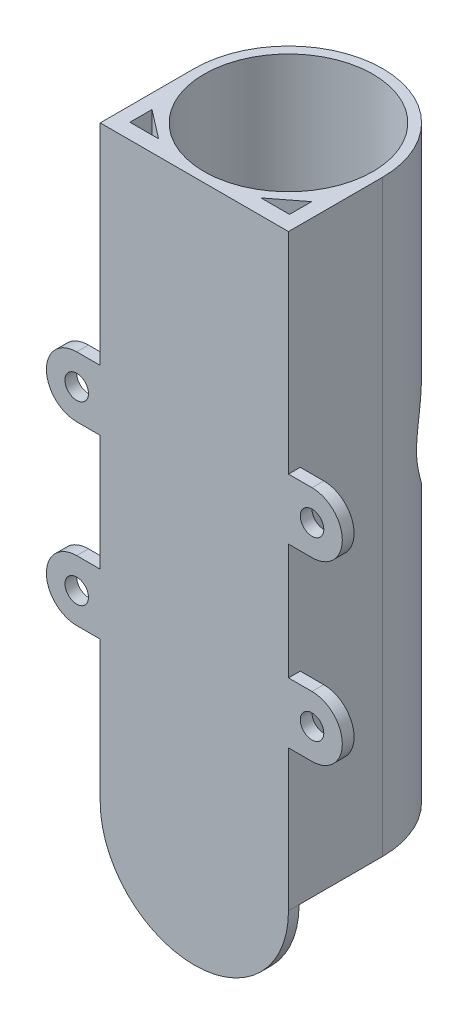
from build123d import *

# Parameters (mm, degrees)
SKETCH1_R           = 14.35
BOSS_EXTRUDE1_DEPTH = 100
CUT_EXTRUDE3_START  = -35
SKETCH2_R           = 13.97
CUT_EXTRUDE3_DEPTH  = 15
BOSS_EXTRUDE3_DEPTH = 1.8
SKETCH6_R           = 2
BOSS_EXTRUDE4_DEPTH = 2


with BuildPart() as part:
    # Sketch1 → Boss-Extrude1 (new body)
    with BuildSketch(Plane(origin=(0, 0, 0), x_dir=(1, 0, 0), z_dir=(0, 1, 0))):
        with BuildLine():
            Line((16, -16), (-16, -16))
            Line((-16, -16), (-16, 0))
            ThreePointArc((-16, 0), (0, 16), (16, 0))
            Line((16, 0), (16, -16))
        make_face()
        Circle(SKETCH1_R, mode=Mode.SUBTRACT)
        Polygon((-13.566960835, -13.387527792), (-8.700031969, -13.387527792), (-13.566960835, -9.631173298), align=None, mode=Mode.SUBTRACT)
        Polygon((13.566960835, -13.387527792), (8.700031969, -13.387527792), (13.566960835, -9.631173298), align=None, mode=Mode.SUBTRACT)
    extrude(amount=BOSS_EXTRUDE1_DEPTH)

    # Sketch2 → Cut-Extrude3 (cut, symmetric)
    with BuildSketch(Plane.XY.offset(16).offset(CUT_EXTRUDE3_START)):
        with Locations((0, 54.866576619)):
            Circle(SKETCH2_R)
    extrude(amount=CUT_EXTRUDE3_DEPTH, both=True, mode=Mode.SUBTRACT)

    # Sketch4 → Boss-Extrude3 (add)
    with BuildSketch(Plane.XY.offset(16)):
        with BuildLine():
            Line((-16, 0), (16, 0))
            ThreePointArc((16, 0), (0, -16), (-16, 0))
        make_face()
    extrude(amount=-BOSS_EXTRUDE3_DEPTH)

    # Sketch6 → Boss-Extrude4 (add)
    # profile 1 of 4: a face of its own
    with BuildSketch(Plane.XY.offset(16)):
        with BuildLine():
            Line((-9.244398852, 34.292623536), (-9.244398852, 23.992623536))
            Line((-9.244398852, 23.992623536), (-20, 23.992623536))
            ThreePointArc((-20, 23.992623536), (-25.15, 29.142623536), (-20, 34.292623536))
            Line((-20, 34.292623536), (-9.244398852, 34.292623536))
        make_face()
        with Locations((-20, 29.142623536)):
            Circle(SKETCH6_R, mode=Mode.SUBTRACT)
    # profile 2 of 4: a face of its own
    with BuildSketch(Plane.XY.offset(16)):
        with BuildLine():
            Line((-20, 53.992109964), (-9.244398852, 53.992109964))
            Line((-9.244398852, 53.992109964), (-9.244398852, 64.293137108))
            Line((-9.244398852, 64.293137108), (-20, 64.293137108))
            ThreePointArc((-20, 64.293137108), (-25.150513572, 59.142623536), (-20, 53.992109964))
        make_face()
        with Locations((-20, 59.142623536)):
            Circle(SKETCH6_R, mode=Mode.SUBTRACT)
    # profile 3 of 4: a face of its own
    with BuildSketch(Plane.XY.offset(16)):
        with BuildLine():
            Line((9.244398852, 64.293137108), (20, 64.293137108))
            ThreePointArc((20, 64.293137108), (25.150513572, 59.142623536), (20, 53.992109964))
            Line((20, 53.992109964), (9.244398852, 53.992109964))
            Line((9.244398852, 53.992109964), (9.244398852, 64.293137108))
        make_face()
        with Locations((20, 59.142623536)):
            Circle(SKETCH6_R, mode=Mode.SUBTRACT)
    # profile 4 of 4: a face of its own
    with BuildSketch(Plane.XY.offset(16)):
        with BuildLine():
            Line((9.244398852, 34.292623536), (9.244398852, 23.992623536))
            Line((9.244398852, 23.992623536), (20, 23.992623536))
            ThreePointArc((20, 23.992623536), (25.15, 29.142623536), (20, 34.292623536))
            Line((20, 34.292623536), (9.244398852, 34.292623536))
        make_face()
        with Locations((20, 29.142623536)):
            Circle(SKETCH6_R, mode=Mode.SUBTRACT)
    extrude(amount=-BOSS_EXTRUDE4_DEPTH)


solid = part.part
